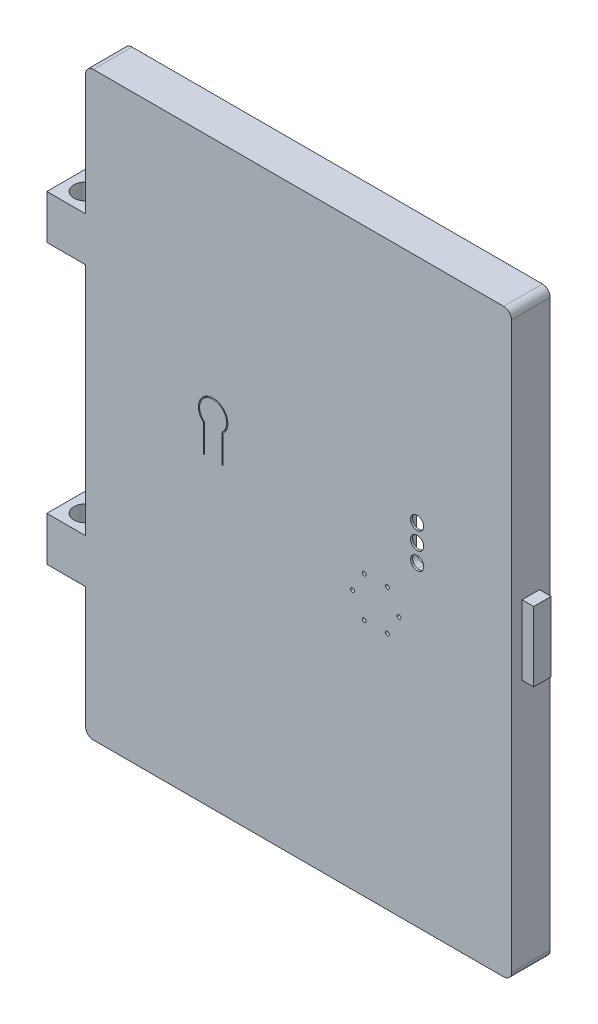
from build123d import *

# Parameters (mm, degrees)
SKETCH1_W              = 110
SKETCH1_H              = 150
BOSS_EXTRUDE1_DEPTH    = 10
CUT_EXTRUDE1_DEPTH     = 6
SKETCH3_R              = 2.5
BOSS_EXTRUDE2_DEPTH    = 18
CUT_EXTRUDE2_START     = -12
SKETCH5_R              = 1.1
CUT_EXTRUDE2_DEPTH     = 5
CUT_EXTRUDE3_START     = 0.5
CUT_EXTRUDE3_DEPTH     = 4
SKETCH7_R              = 1.875
BOSS_EXTRUDE3_DEPTH    = 11.5
CUT_EXTRUDE4_DEPTH     = 4
SKETCH9_W              = 10
SKETCH9_H              = 11.4
BOSS_EXTRUDE4_DEPTH    = 10
SKETCH10_R             = 3
CUT_EXTRUDE5_DEPTH     = 161.819432905
SKETCH11_W             = 4.5
SKETCH11_H             = 18
BOSS_EXTRUDE5_DEPTH    = 3
FILLET1_R              = 2
CUT_EXTRUDE6_START     = -4
CUT_EXTRUDE6_OUTLINE_R = 0.5
CUT_EXTRUDE6_DEPTH     = 4


# Read off the part's stored shape, not the designer's step: Cut-Extrude6
with BuildPart() as part:
    # Sketch1 → Boss-Extrude1 (new body)
    with BuildSketch(Plane.XY):
        with Locations((55, 75)):
            Rectangle(SKETCH1_W, SKETCH1_H)
    extrude(amount=BOSS_EXTRUDE1_DEPTH)

    # Sketch2 → Cut-Extrude1 (cut)
    with BuildSketch(Plane(origin=(0, 0, 0), x_dir=(-1, 0, 0), z_dir=(0, 0, -1))):
        with BuildLine():
            Line((-93, 53), (-7, 53))
            ThreePointArc((-7, 53), (-5.585786438, 53.585786438), (-5, 55))
            Line((-5, 55), (-5, 113))
            ThreePointArc((-5, 113), (-5.585786438, 114.414213562), (-7, 115))
            Line((-7, 115), (-93, 115))
            ThreePointArc((-93, 115), (-94.414213562, 114.414213562), (-95, 113))
            Line((-95, 113), (-95, 55))
            ThreePointArc((-95, 55), (-94.414213562, 53.585786438), (-93, 53))
        make_face()
    extrude(amount=-CUT_EXTRUDE1_DEPTH, mode=Mode.SUBTRACT)

    # Sketch3 → Boss-Extrude2 (add)
    with BuildSketch(Plane(origin=(0, 0, 6), x_dir=(-1, 0, 0), z_dir=(0, 0, -1))):
        with Locations(Location((-91.46, 95.2, 0), (0, 0, 180))):
            Circle(SKETCH3_R)
        with Locations(Location((-70.96, 111.2, 0), (0, 0, 180))):
            Circle(SKETCH3_R)
        with Locations(Location((-9.46, 110.2, 0), (0, 0, 180))):
            Circle(SKETCH3_R)
        with Locations(Location((-9.46, 76.2, 0), (0, 0, 180))):
            Circle(SKETCH3_R)
        with Locations(Location((-24.96, 58.2, 0), (0, 0, 180))):
            Circle(SKETCH3_R)
        with Locations(Location((-51.96, 58.2, 0), (0, 0, 180))):
            Circle(SKETCH3_R)
        with Locations(Location((-91.46, 58.2, 0), (0, 0, 180))):
            Circle(SKETCH3_R)
    extrude(amount=BOSS_EXTRUDE2_DEPTH)

    # Sketch5 → Cut-Extrude2 (cut)
    with BuildSketch(Plane.XY.offset(CUT_EXTRUDE2_START)):
        with Locations(Location((91.46, 58.2, 0), (0, 0, 180))):
            Circle(SKETCH5_R)
        with Locations(Location((51.96, 58.2, 0), (0, 0, 180))):
            Circle(SKETCH5_R)
        with Locations(Location((24.96, 58.2, 0), (0, 0, 180))):
            Circle(SKETCH5_R)
        with Locations(Location((9.46, 76.2, 0), (0, 0, 180))):
            Circle(SKETCH5_R)
        with Locations(Location((9.46, 110.2, 0), (0, 0, 180))):
            Circle(SKETCH5_R)
        with Locations(Location((70.96, 111.2, 0), (0, 0, 180))):
            Circle(SKETCH5_R)
        with Locations(Location((91.46, 95.2, 0), (0, 0, 180))):
            Circle(SKETCH5_R)
    extrude(amount=CUT_EXTRUDE2_DEPTH, mode=Mode.SUBTRACT)

    # Sketch6 → Cut-Extrude3 (cut)
    with BuildSketch(Plane(origin=(0, 0, 6), x_dir=(-1, 0, 0), z_dir=(0, 0, -1)).offset(CUT_EXTRUDE3_START)):
        with BuildLine():
            Line((-87.5, 78), (-83.5, 78))
            ThreePointArc((-83.5, 78), (-82.085786438, 78.585786438), (-81.5, 80))
            Line((-81.5, 80), (-81.5, 91))
            ThreePointArc((-81.5, 91), (-82.085786438, 92.414213562), (-83.5, 93))
            Line((-83.5, 93), (-87.5, 93))
            ThreePointArc((-87.5, 93), (-88.914213562, 92.414213562), (-89.5, 91))
            Line((-89.5, 91), (-89.5, 80))
            ThreePointArc((-89.5, 80), (-88.914213562, 78.585786438), (-87.5, 78))
        make_face()
    extrude(amount=-CUT_EXTRUDE3_DEPTH, mode=Mode.SUBTRACT)

    # Sketch7 → Boss-Extrude3 (add)
    with BuildSketch(Plane(origin=(0, 0, 6), x_dir=(-1, 0, 0), z_dir=(0, 0, -1))):
        with Locations(Location((-32.95, 88.15, 0), (0, 0, 180))):
            Circle(SKETCH7_R)
    extrude(amount=BOSS_EXTRUDE3_DEPTH)

    # Sketch8 → Cut-Extrude4 (cut)
    with BuildSketch(Plane.XY.offset(10)):
        with BuildLine():
            Line((30.7, 78.15), (30.7, 85.469048676))
            ThreePointArc((30.7, 85.469048676), (32.95, 91.65), (35.2, 85.469048676))
            Line((35.2, 85.469048676), (35.2, 78.15))
            Line((35.2, 78.15), (35.5, 78.15))
            Line((35.5, 78.15), (35.5, 85.332643083))
            ThreePointArc((35.5, 85.332643083), (32.95, 91.95), (30.4, 85.332643083))
            Line((30.4, 85.332643083), (30.4, 78.15))
            Line((30.4, 78.15), (30.7, 78.15))
        make_face()
    extrude(amount=-CUT_EXTRUDE4_DEPTH, mode=Mode.SUBTRACT)

    # Sketch9 → Boss-Extrude4 (add)
    with BuildSketch(Plane.ZY):
        with Locations((5, 39)):
            Rectangle(SKETCH9_W, SKETCH9_H)
        with Locations((5, 111)):
            Rectangle(SKETCH9_W, SKETCH9_H)
    extrude(amount=BOSS_EXTRUDE4_DEPTH)

    # Sketch10 → Cut-Extrude5 (cut, through all)
    with BuildSketch(Plane(origin=(0, 116.7, 0), x_dir=(1, 0, 0), z_dir=(0, 1, 0))):
        with Locations(Location((-5, -5, 0), (0, 0, 270))):
            Circle(SKETCH10_R)
    extrude(amount=-CUT_EXTRUDE5_DEPTH, mode=Mode.SUBTRACT)

    # Sketch11 → Boss-Extrude5 (add)
    with BuildSketch(Plane(origin=(110, 0, 0), x_dir=(0, 0, -1), z_dir=(1, 0, 0))):
        with Locations((-5, 75)):
            Rectangle(SKETCH11_W, SKETCH11_H)
    extrude(amount=BOSS_EXTRUDE5_DEPTH)

    # Fillet1
    fillet1_edges = [part.edges().sort_by_distance(p)[0] for p in [
        (0, 150, 5),
        (110, 150, 5),
        (110, 0, 5),
        (0, 0, 5),
    ]]
    fillet(fillet1_edges, radius=FILLET1_R)

    # Cut-Extrude6 outline → Cut-Extrude6 (cut)
    with BuildSketch(Plane.XY.offset(10).offset(CUT_EXTRUDE6_START)):
        with BuildLine():
            add(Edge.make_bspline(
                [(83.934390614, 85.912779414), (83.934390614, 85.468732827), (84.302250852, 84.580639652), (85.634390614, 84.028849296), (86.966530376, 84.580639652), (87.518320733, 85.912779414), (86.966530376, 87.244919177), (85.634390614, 87.796709533), (84.302250852, 87.244919177), (83.934390614, 86.356826002), (83.934390614, 85.912779414)],
                knots=[0, 0, 0, 0, 0.125, 0.25, 0.375, 0.5, 0.625, 0.75, 0.875, 1, 1, 1, 1], degree=3))
        make_face()
        with BuildLine():
            add(Edge.make_bspline(
                [(83.948690614, 81.393579414), (83.948690614, 80.949532827), (84.316550852, 80.061439652), (85.648690614, 79.509649296), (86.980830376, 80.061439652), (87.532620733, 81.393579414), (86.980830376, 82.725719177), (85.648690614, 83.277509533), (84.316550852, 82.725719177), (83.948690614, 81.837626002), (83.948690614, 81.393579414)],
                knots=[0, 0, 0, 0, 0.125, 0.25, 0.375, 0.5, 0.625, 0.75, 0.875, 1, 1, 1, 1], degree=3))
        make_face()
        with BuildLine():
            add(Edge.make_bspline(
                [(83.934990614, 90.400579414), (83.934990614, 89.956532827), (84.302850852, 89.068439652), (85.634990614, 88.516649296), (86.967130376, 89.068439652), (87.518920733, 90.400579414), (86.967130376, 91.732719177), (85.634990614, 92.284509533), (84.302850852, 91.732719177), (83.934990614, 90.844626002), (83.934990614, 90.400579414)],
                knots=[0, 0, 0, 0, 0.125, 0.25, 0.375, 0.5, 0.625, 0.75, 0.875, 1, 1, 1, 1], degree=3))
        make_face()
        with Locations((68.959990614, 67.000579414)):
            Circle(CUT_EXTRUDE6_OUTLINE_R)
        with Locations((71.959990614, 72.196731837)):
            Circle(CUT_EXTRUDE6_OUTLINE_R)
        with Locations((77.959990614, 72.196731837)):
            Circle(CUT_EXTRUDE6_OUTLINE_R)
        with Locations((80.959990614, 67.000579414)):
            Circle(CUT_EXTRUDE6_OUTLINE_R)
        with Locations((77.959990614, 61.804426992)):
            Circle(CUT_EXTRUDE6_OUTLINE_R)
        with Locations((71.959990614, 61.804426992)):
            Circle(CUT_EXTRUDE6_OUTLINE_R)
    extrude(amount=CUT_EXTRUDE6_DEPTH, mode=Mode.SUBTRACT)


solid = part.part
